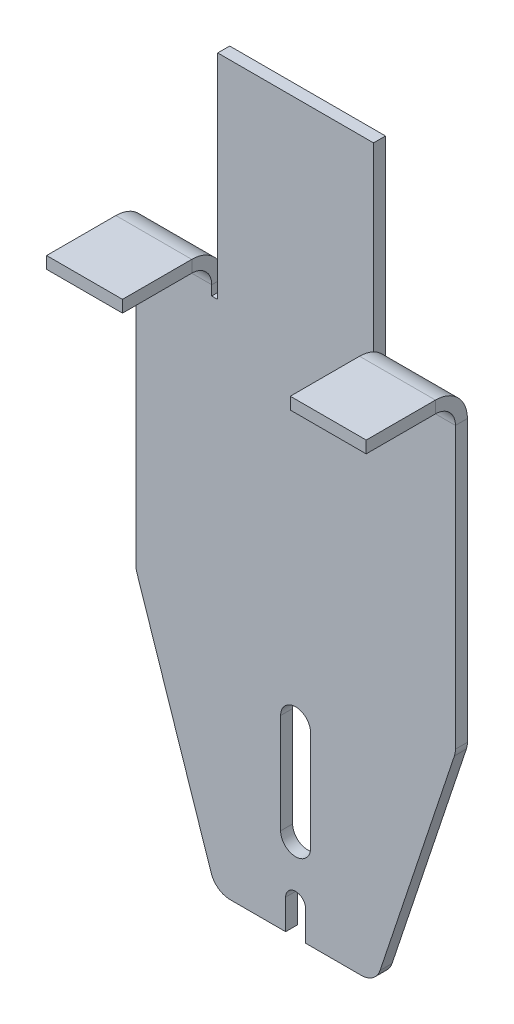
from build123d import *

# Parameters (mm, degrees)
BASE_FLANGE1_DEPTH     = 6
SKETCHED_START         = -80
SKETCHED_BEND1_DEPTH   = 38
SKETCHED_START_2       = 42
SKETCHED_BEND1_2_DEPTH = 38
SKETCHED_BEND1_3_DEPTH = 38
SKETCHED_BEND1_4_DEPTH = 38


# Read off the part's stored shape, not the designer's step: Sketched Bend1
# Sheet-metal steps are written as plain solids
with BuildPart() as part:
    # Sketch1 → Base-Flange1 (new body)
    with BuildSketch(Plane.XY):
        with BuildLine():
            Line((80, 189.59), (80, 54.12))
            ThreePointArc((80, 54.12), (79.87085305, 52.518044922), (79.486747986, 50.957467367))
            Line((79.486747986, 50.957467367), (42.276747986, -60.662532633))
            ThreePointArc((42.276747986, -60.662532633), (38.636993829, -65.612500426), (32.79, -67.5))
            Line((32.79, -67.5), (5, -67.5))
            Line((5, -67.5), (5, -52.5))
            ThreePointArc((5, -52.5), (0, -47.5), (-5, -52.5))
            Line((-5, -52.5), (-5, -67.5))
            Line((-5, -67.5), (-32.79, -67.5))
            ThreePointArc((-32.79, -67.5), (-38.636993829, -65.612500426), (-42.276747986, -60.662532633))
            Line((-42.276747986, -60.662532633), (-79.486747986, 50.957467367))
            ThreePointArc((-79.486747986, 50.957467367), (-79.87085305, 52.518044922), (-80, 54.12))
            Line((-80, 54.12), (-80, 189.59))
            Line((-80, 189.59), (-80, 249.59))
            Line((-80, 249.59), (-42, 249.59))
            Line((-42, 249.59), (-42, 189.59))
            Line((-42, 189.59), (-39, 189.59))
            Line((-39, 189.59), (-39, 296.5))
            Line((-39, 296.5), (39, 296.5))
            Line((39, 296.5), (39, 189.59))
            Line((39, 189.59), (42, 189.59))
            Line((42, 189.59), (42, 249.59))
            Line((42, 249.59), (80, 249.59))
            Line((80, 249.59), (80, 189.59))
        make_face()
        with BuildLine():
            Line((7.5, 25), (7.5, -25))
            ThreePointArc((7.5, -25), (0, -32.5), (-7.5, -25))
            Line((-7.5, -25), (-7.5, 25))
            ThreePointArc((-7.5, 25), (0, 32.5), (7.5, 25))
        make_face(mode=Mode.SUBTRACT)
    extrude(amount=-BASE_FLANGE1_DEPTH)

    # Sketched Bend1 outline → Sketched Bend1 (cut)
    with BuildSketch(Plane.YZ.offset(SKETCHED_START)):
        with BuildLine():
            Line((249.59, 0), (206.989995997, 0))
            ThreePointArc((206.989995997, 0), (201.42820323, -4.422205102), (194.5, -6))
            Line((194.5, -6), (249.59, -6))
            Line((249.59, -6), (249.59, 0))
        make_face()
    extrude(amount=SKETCHED_BEND1_DEPTH, mode=Mode.SUBTRACT)

    # Sketched Bend1 2 outline → Sketched Bend1 2 (cut)
    with BuildSketch(Plane.YZ.offset(SKETCHED_START_2)):
        with BuildLine():
            Line((249.59, 0), (206.989995997, 0))
            ThreePointArc((206.989995997, 0), (201.42820323, -4.422205102), (194.5, -6))
            Line((194.5, -6), (249.59, -6))
            Line((249.59, -6), (249.59, 0))
        make_face()
    extrude(amount=SKETCHED_BEND1_2_DEPTH, mode=Mode.SUBTRACT)

    # Sketched Bend1 3 outline → Sketched Bend1 3 (add)
    with BuildSketch(Plane.YZ.offset(SKETCHED_START)):
        with BuildLine():
            Line((210.5, 10), (210.5, 44.669647752))
            Line((210.5, 44.669647752), (204.5, 44.669647752))
            Line((204.5, 44.669647752), (204.5, 10))
            ThreePointArc((204.5, 10), (201.571067812, 2.928932188), (194.5, 0))
            Line((194.5, 0), (206.989995997, 0))
            ThreePointArc((206.989995997, 0), (209.597018513, 4.700940458), (210.5, 10))
        make_face()
    extrude(amount=SKETCHED_BEND1_3_DEPTH)

    # Sketched Bend1 4 outline → Sketched Bend1 4 (add)
    with BuildSketch(Plane.YZ.offset(SKETCHED_START_2)):
        with BuildLine():
            Line((210.5, 10), (210.5, 44.669647752))
            Line((210.5, 44.669647752), (204.5, 44.669647752))
            Line((204.5, 44.669647752), (204.5, 10))
            ThreePointArc((204.5, 10), (201.571067812, 2.928932188), (194.5, 0))
            Line((194.5, 0), (206.989995997, 0))
            ThreePointArc((206.989995997, 0), (209.597018513, 4.700940458), (210.5, 10))
        make_face()
    extrude(amount=SKETCHED_BEND1_4_DEPTH)


solid = part.part
